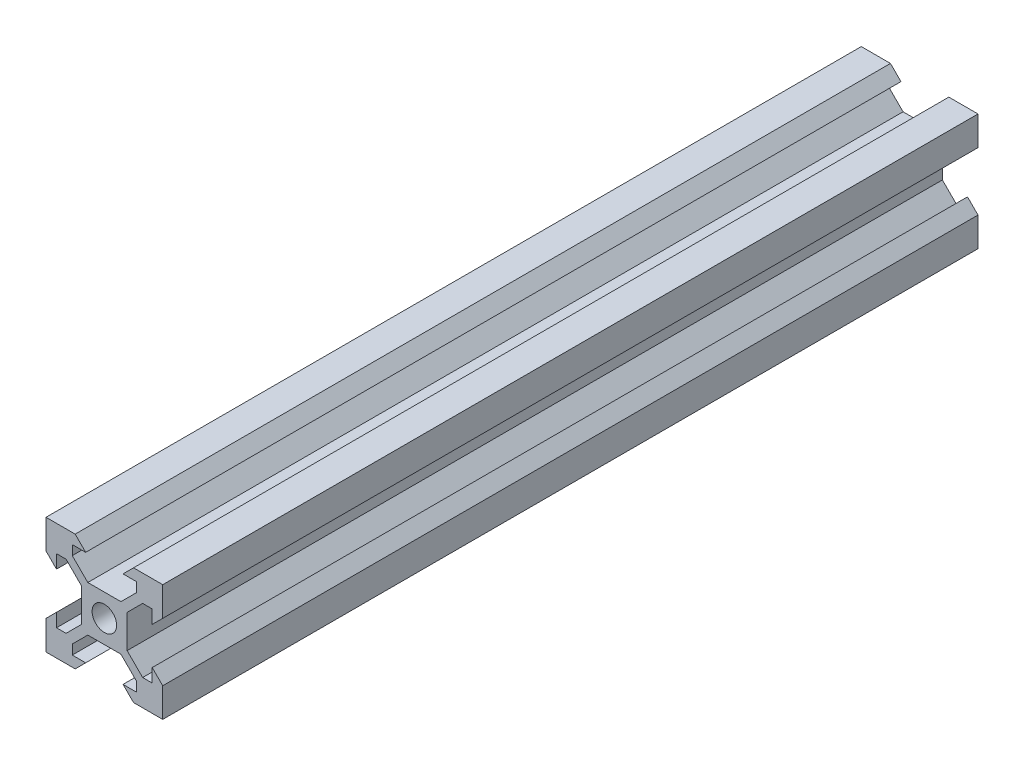
from build123d import *

# Parameters (mm, degrees)
SKETCH1_R           = 2.1
BOSS_EXTRUDE1_DEPTH = 69.85


with BuildPart() as part:
    # Sketch1 → Boss-Extrude1 (new, symmetric)
    with BuildSketch(Plane.XY):
        Polygon((-10, 10), (-5, 10), (-3.2, 8.2), (-5.499339828, 8.2), (-5.499339828, 6.56), (-2.84, 3.900660172), (2.84, 3.900660172), (5.499339828, 6.56), (5.499339828, 8.2), (3.2, 8.2), (5, 10), (10, 10), (10, 5), (8.2, 3.2), (8.2, 5.499339828), (6.56, 5.499339828), (3.900660172, 2.84), (3.900660172, -2.84), (6.56, -5.499339828), (8.2, -5.499339828), (8.2, -3.2), (10, -5), (10, -10), (5, -10), (3.2, -8.2), (5.499339828, -8.2), (5.499339828, -6.56), (2.84, -3.900660172), (-2.84, -3.900660172), (-5.499339828, -6.56), (-5.499339828, -8.2), (-3.2, -8.2), (-5, -10), (-10, -10), (-10, -5), (-8.2, -3.2), (-8.2, -5.499339828), (-6.56, -5.499339828), (-3.900660172, -2.84), (-3.900660172, 2.84), (-6.56, 5.499339828), (-8.2, 5.499339828), (-8.2, 3.2), (-10, 5), align=None)
        Circle(SKETCH1_R, mode=Mode.SUBTRACT)
    extrude(amount=BOSS_EXTRUDE1_DEPTH, both=True)


solid = part.part
